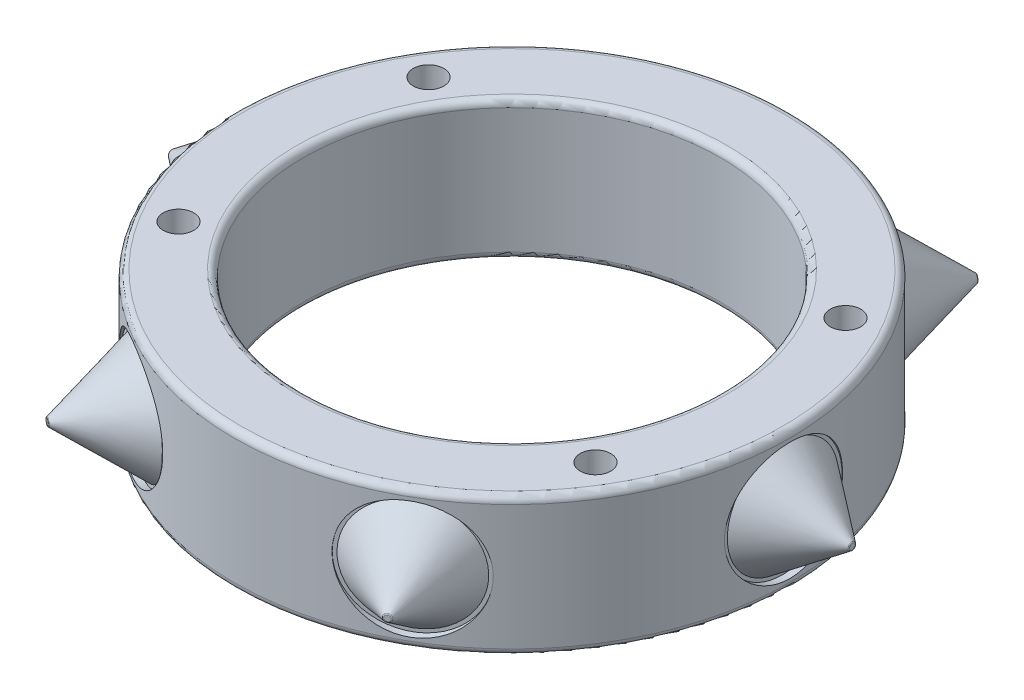
from build123d import *

# Parameters (mm, degrees)
EXTRUDE_1_DEPTH          = 5
EXTRUDE_1_DEPTH_BACK     = 5
SKETCH_1_R               = 20
SKETCH_1_R_2             = 15
FILLET_1_R               = 0.5
PATTERN_CIRCULAR_5_COUNT = 6
SKETCH_3_R               = 4.25
CUT_EXTRUDE_1_DEPTH      = 10
PATTERN_CIRCULAR_6_COUNT = 6
SKETCH_4_R               = 1.1
CUT_EXTRUDE_2_DEPTH      = 34.989151419


with BuildPart() as part:
    # ｽｹｯﾁ1 → ﾎﾞｽ - 押し出し1 (new, two sides: drawn at the far end of the back side and taken through both)
    with BuildSketch(Plane(origin=(0, 0, 0), x_dir=(1, 0, 0), z_dir=(0, 1, 0)).offset(-EXTRUDE_1_DEPTH_BACK)):
        Circle(SKETCH_1_R)
        Circle(SKETCH_1_R_2, mode=Mode.SUBTRACT)
    extrude(amount=EXTRUDE_1_DEPTH + EXTRUDE_1_DEPTH_BACK)

    # ﾌｨﾚｯﾄ1
    fillet_1_edges = [part.edges().sort_by_distance(p)[0] for p in [
        (-15, -5, 0),
        (-20, -5, 0),
        (-15, 5, 0),
        (-20, 5, 0),
    ]]
    fillet(fillet_1_edges, radius=FILLET_1_R)

    # ｽｹｯﾁ3 → ｶｯﾄ - 押し出し1 (cut)
    with BuildSketch(Plane(origin=(-9.75, 0, 16.887495374), x_dir=(-0.8660254037844434, 0, -0.49999999999999195), z_dir=(0.49999999999999195, 0, -0.8660254037844434))):
        Circle(SKETCH_3_R)
    cut_extrude_1 = extrude(amount=-CUT_EXTRUDE_1_DEPTH, mode=Mode.SUBTRACT)

    # 円形ﾊﾟﾀｰﾝ6: ｶｯﾄ - 押し出し1 ×6 about axis
    pattern_circular_6_axis = Axis((0, -4.5, 0), (0, 1, 0))
    for i in range(1, PATTERN_CIRCULAR_6_COUNT):
        add(cut_extrude_1.rotate(pattern_circular_6_axis, i * 360 / PATTERN_CIRCULAR_6_COUNT), mode=Mode.SUBTRACT)

    # ｽｹｯﾁ4 → ｶｯﾄ - 押し出し2 (cut, through all)
    with BuildSketch(Plane(origin=(0, 5, 0), x_dir=(1, 0, 0), z_dir=(0, 1, 0))):
        with Locations((15.00833102, 9)):
            Circle(SKETCH_4_R)
        with Locations((15.00833102, -9)):
            Circle(SKETCH_4_R)
        with Locations((-15.00833102, -9)):
            Circle(SKETCH_4_R)
        with Locations((-15.00833102, 9)):
            Circle(SKETCH_4_R)
    extrude(amount=-CUT_EXTRUDE_2_DEPTH, mode=Mode.SUBTRACT)


with BuildPart() as body_2:
    # ｽｹｯﾁ2 → 回転1 (revolve)
    with BuildSketch(Plane.XY):
        with BuildLine():
            ThreePointArc((24.5, 0.2), (24.489442719, 0.24472136), (24.46, 0.28))
            Line((24.46, 0.28), (19.5, 4))
            Line((19.5, 4), (19.5, 0))
            Line((19.5, 0), (24.5, 0))
            Line((24.5, 0), (24.5, 0.2))
        make_face()
    revolve(axis=Axis((24.5, 0, 0), (-1, 0, 0)))


with BuildPart() as pattern_circular_5_1:
    # 円形ﾊﾟﾀｰﾝ5: pattern copy
    add(body_2.part.rotate(Axis((0, -4.5, 0), (0, 1, 0)), 1 * 360 / PATTERN_CIRCULAR_5_COUNT))


with BuildPart() as pattern_circular_5_2:
    # 円形ﾊﾟﾀｰﾝ5: pattern copy
    add(body_2.part.rotate(Axis((0, -4.5, 0), (0, 1, 0)), 2 * 360 / PATTERN_CIRCULAR_5_COUNT))


with BuildPart() as pattern_circular_5_3:
    # 円形ﾊﾟﾀｰﾝ5: pattern copy
    add(body_2.part.rotate(Axis((0, -4.5, 0), (0, 1, 0)), 3 * 360 / PATTERN_CIRCULAR_5_COUNT))


with BuildPart() as pattern_circular_5_4:
    # 円形ﾊﾟﾀｰﾝ5: pattern copy
    add(body_2.part.rotate(Axis((0, -4.5, 0), (0, 1, 0)), 4 * 360 / PATTERN_CIRCULAR_5_COUNT))


with BuildPart() as pattern_circular_5_5:
    # 円形ﾊﾟﾀｰﾝ5: pattern copy
    add(body_2.part.rotate(Axis((0, -4.5, 0), (0, 1, 0)), 5 * 360 / PATTERN_CIRCULAR_5_COUNT))


solid = Compound([part.part, body_2.part, pattern_circular_5_1.part, pattern_circular_5_2.part, pattern_circular_5_3.part, pattern_circular_5_4.part, pattern_circular_5_5.part])
